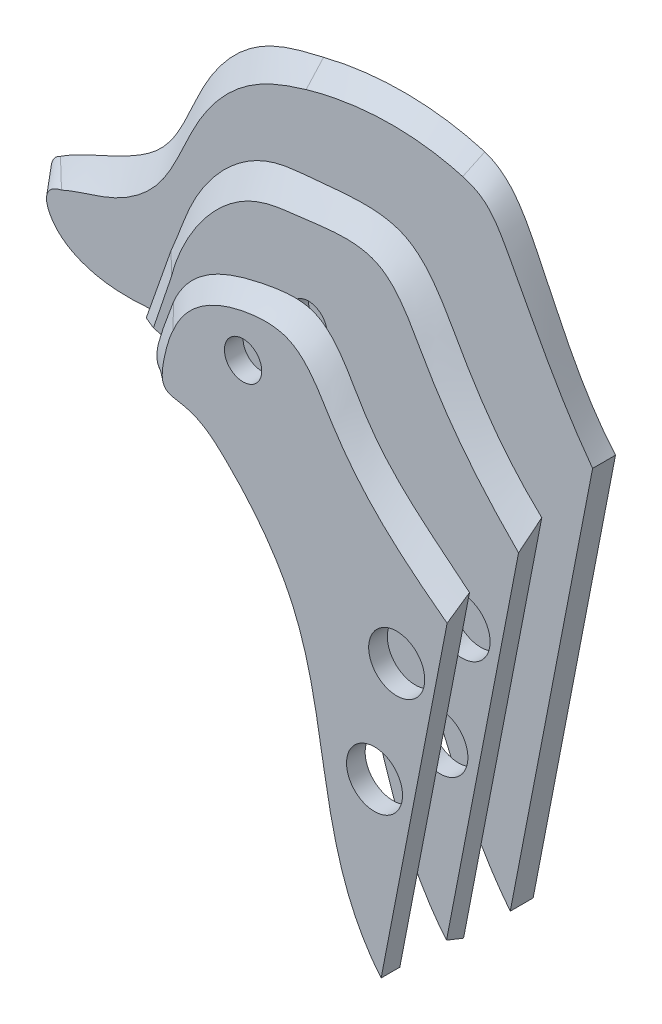
from build123d import *

# Parameters (mm, degrees)
SKETCH12_R         = 4
CUT_EXTRUDE1_DEPTH = 5
SKETCH10_R         = 4
CUT_EXTRUDE2_DEPTH = 5
CUT_EXTRUDE3_START = -18
SKETCH13_R         = 6
CUT_EXTRUDE3_DEPTH = 18
CUT_EXTRUDE4_START = -18
SKETCH14_R         = 6
CUT_EXTRUDE4_DEPTH = 18


with BuildPart() as part:
    # Loft4: read off the stored shape, not the designer's step
    # Loft4: loft between two sections, ruled curve by curve
    loft4_from = [
        Edge.make_bspline([(77.958571883, 18.995672942, 0), (69.81306901, 28.562918235, 0), (65.663673482, 39.687649157, 0), (58.332437588, 53.951272654, 0), (55.536112417, 58.481649378, 0), (51.421018516, 60.793800861, 0), (49.974275634, 61.268976489, 0)], [0, 0, 0, 0, 0.696575786, 0.725812228, 0.916565813, 1, 1, 1, 1], 3),
        Edge.make_bspline([(49.974275634, 61.268976489, 0), (49.505716798, 61.406841614, 0), (43.396175688, 63.117948118, 0), (31.692607742, 64.373316716, 0), (20.540624005, 62.818902632, 0), (15.436834961, 61.543674215, 0)], [0, 0, 0, 0, 0.041936811, 0.544812334, 1, 1, 1, 1], 3),
        Edge.make_bspline([(15.436834961, 61.543674215, 0), (15.229844727, 61.49722644, 0), (12.630046118, 60.909628297, 0), (8.852473068, 59.95517464, 0), (4.569159319, 58.262211831, 0), (2.290145257, 57.038982671, 0), (-0.755223748, 55.098290452, 0), (-5.087657656, 51.323943166, 0), (-8.529098205, 46.45825302, 0), (-10.270791417, 43.226753988, 0), (-11.925454756, 40.004551376, 0), (-13.772547956, 35.588722463, 0), (-16.615410908, 30.452471026, 0), (-18.758572682, 27.837546837, 0), (-19.892697716, 26.753522216, 0), (-22.268680775, 24.664616568, 0), (-25.527570244, 22.686326073, 0), (-30.393409006, 20.320590313, 0), (-35.158615589, 18.181790597, 0), (-38.845895672, 16.376295987, 0), (-40.910146468, 14.998995279, 0)], [0, 0, 0, 0, 0.008351016, 0.1049053, 0.153071192, 0.189385639, 0.206568258, 0.295206273, 0.414174613, 0.43957708, 0.43957708, 0.556768864, 0.627695873, 0.670087142, 0.689418603, 0.689418603, 0.794559115, 0.838688981, 0.902345365, 1, 1, 1, 1], 3),
        Edge.make_bspline([(-40.910146468, 14.998995279, 0), (-41.313718624, 14.828048382, 0), (-42.104713346, 14.297027207, 0), (-42.823987538, 12.995820262, 0), (-43.100731096, 10.874739053, 0), (-42.647398924, 9.090867466, 0), (-41.812446812, 7.502185164, 0), (-40.799579849, 6.038848574, 0), (-38.745656813, 4.170628409, 0), (-36.490997878, 2.800447275, 0), (-32.721357575, 0.934472543, 0), (-27.187395601, -0.751361165, 0), (-21.050868409, -1.183335038, 0), (-16.681022909, -1.174819004, 0), (-14.710339354, -1.134018104, 0), (-13.528988879, -1.088693105, 0), (-9.033717543, -0.8957394, 0), (-4.818646922, -0.756844424, 0), (1.897478031, -0.525083956, 0), (6.518900926, -0.327620546, 0), (11.135475759, -0.043294434, 0), (14.366054176, 0.188286269, 0), (16.103205928, 0.286260616, 0), (17.833902749, 0.197736688, 0), (19.708253567, -0.001939549, 0), (22.042342351, -0.610613913, 0), (24.756897545, -2.306849034, 0), (27.544732721, -4.919996212, 0), (30.666363777, -9.419394792, 0), (33.764700654, -16.327461193, 0), (35.669469236, -21.763825494, 0), (38.48766089, -29.778340729, 0), (41.341119491, -37.75819805, 0), (45.918265172, -48.893307205, 0), (51.231788136, -59.939494455, 0), (56.452163104, -67.78048221, 0), (60.323211324, -71.952286576, 0)], [0, 0, 0, 0, 0.00837307, 0.017762655, 0.027733621, 0.048779718, 0.05204074, 0.06201082, 0.082660237, 0.104704742, 0.112275845, 0.163078864, 0.214327654, 0.229400171, 0.246603709, 0.251993788, 0.251993788, 0.332593964, 0.332593964, 0.380426295, 0.420991626, 0.420991626, 0.442329007, 0.454134962, 0.454134962, 0.478345256, 0.499621291, 0.514833285, 0.551173963, 0.603629486, 0.659162578, 0.661233481, 0.765955244, 0.821108721, 0.891270538, 1, 1, 1, 1], 3),
        Edge.make_line((77.958571883, 18.995672942, 0), (60.323211324, -71.952286576, 0)),
    ]
    loft4_to = [
        Edge.make_bspline([(77.958571883, 18.995672942, 4.9), (70.675285123, 28.860678419, 4.9), (65.849031326, 38.760145453, 4.9), (58.400678834, 52.491068252, 4.9), (55.778104722, 57.167288543, 4.9), (51.491781801, 58.81911588, 4.9), (50.139948714, 59.21860019, 4.9)], [0, 0, 0, 0, 0.696575786, 0.725812228, 0.916565813, 1, 1, 1, 1], 3),
        Edge.make_bspline([(50.139948714, 59.21860019, 4.9), (49.677036293, 59.355396849, 4.9), (43.590822432, 60.975409128, 4.9), (32.309547383, 61.882945307, 4.9), (21.583293464, 60.023768009, 4.9), (16.609520864, 58.58584891, 4.9)], [0, 0, 0, 0, 0.041936811, 0.544812334, 1, 1, 1, 1], 3),
        Edge.make_bspline([(16.609520864, 58.58584891, 4.9), (16.416431661, 58.530026766, 4.9), (13.993166246, 57.818290236, 4.9), (10.501166746, 56.588137156, 4.9), (6.63124439, 54.646669896, 4.9), (4.574071078, 53.368454521, 4.9), (1.821241951, 51.395991788, 4.9), (-2.143696469, 47.723622385, 4.9), (-5.432090011, 43.076605166, 4.9), (-7.097627007, 39.999493185, 4.9), (-8.695049459, 36.936662836, 4.9), (-10.512640041, 32.752457976, 4.9), (-13.1096156, 27.93951048, 4.9), (-14.929448281, 25.403874873, 4.9), (-15.888560217, 24.302297962, 4.9), (-17.889502616, 22.132453113, 4.9), (-20.72457484, 19.867059753, 4.9), (-25.350118352, 17.475154803, 4.9), (-30.130276288, 15.798353409, 4.9), (-33.822410743, 14.672026557, 4.9), (-35.791116406, 13.75, 4.9)], [0, 0, 0, 0, 0.008351016, 0.1049053, 0.153071192, 0.189385639, 0.206568258, 0.295206273, 0.414174613, 0.43957708, 0.43957708, 0.556768864, 0.627695873, 0.670087142, 0.689418603, 0.689418603, 0.794559115, 0.838688981, 0.902345365, 1, 1, 1, 1], 3),
        Edge.make_bspline([(-35.791116406, 13.75, 4.9), (-36.468482867, 13.600033317, 4.9), (-37.638910897, 13.160589203, 4.9), (-38.700615101, 12.161648471, 4.9), (-39.24000611, 10.367918808, 4.9), (-38.629330815, 8.615115367, 4.9), (-37.679369076, 7.059468177, 4.9), (-36.59934843, 5.659407984, 4.9), (-34.490964387, 3.942949495, 4.9), (-32.12134693, 2.819795092, 4.9), (-28.187774047, 1.479861186, 4.9), (-22.677443886, 0.775369264, 4.9), (-16.670801527, 1.202620362, 4.9), (-12.405749376, 1.625965635, 4.9), (-10.491203974, 1.815280361, 4.9), (-9.348765228, 1.914923081, 4.9), (-5.005483296, 2.282083922, 4.9), (-1.001541337, 2.456989607, 4.9), (5.48641984, 2.653141126, 4.9), (9.996022261, 2.754429051, 4.9), (14.683270709, 2.87722852, 4.9), (17.786854709, 2.607843598, 4.9), (19.398195483, 2.363528433, 4.9), (20.877055705, 1.880390579, 4.9), (22.435534005, 1.26843352, 4.9), (24.27800178, 0.270403694, 4.9), (26.457340732, -1.552617288, 4.9), (28.833903759, -4.15075873, 4.9), (31.791100171, -8.600655202, 4.9), (35.10202664, -16.032322337, 4.9), (37.228190444, -22.181159642, 4.9), (40.330728791, -31.059627703, 4.9), (43.367787061, -39.563350008, 4.9), (47.924120058, -50.692640146, 4.9), (52.906874614, -61.175537076, 4.9), (57.307552014, -68.156327996, 4.9), (60.323211324, -71.952286576, 4.9)], [0, 0, 0, 0, 0.00837307, 0.017762655, 0.027733621, 0.048779718, 0.05204074, 0.06201082, 0.082660237, 0.104704742, 0.112275845, 0.163078864, 0.214327654, 0.229400171, 0.246603709, 0.251993788, 0.251993788, 0.332593964, 0.332593964, 0.380426295, 0.420991626, 0.420991626, 0.442329007, 0.454134962, 0.454134962, 0.478345256, 0.499621291, 0.514833285, 0.551173963, 0.603629486, 0.659162578, 0.661233481, 0.765955244, 0.821108721, 0.891270538, 1, 1, 1, 1], 3),
        Edge.make_line((77.958571883, 18.995672942, 4.9), (60.323211324, -71.952286576, 4.9)),
    ]
    loft4 = Solid(Shell([*[Face.make_surface_from_curves(loft4_from[k], loft4_to[k]) for k in range(5)], Face(Wire(loft4_from)), Face(Wire(loft4_to))]))
    add(loft4)


with BuildPart() as body_2:
    # Sketch5 → Loft5 section 0
    with BuildSketch(Plane.XY.offset(14.9)):
        with BuildLine():
            Line((-2.33970387, 24.231457774), (-7.638772242, 9.119299826))
            add(Edge.make_bspline(
                [(-7.638772242, 9.119299826), (-4.259737159, 8.836488543), (3.564253031, 8.997546536), (13.523482278, 6.127231205), (26.16330004, 2.319373894), (44.43095779, -25.390898016), (45.334066891, -53.607968411), (60.323211324, -71.952286576)],
                knots=[0, 0, 0, 0, 0.088461522, 0.200516231, 0.268799829, 0.424604481, 1, 1, 1, 1], degree=3))
            Line((60.323211324, -71.952286576), (77.071004751, 14.418368197))
            add(Edge.make_bspline(
                [(-2.33970387, 24.231457774), (-0.649462445, 28.043974331), (2.749318341, 39.4489624), (14.839002739, 51.983221928), (32.000008474, 52.956004986), (49.917527377, 55.590584627), (61.260685021, 33.127982199), (69.736181012, 21.279194864), (77.071004751, 14.418368197)],
                knots=[0.098402223, 0.098402223, 0.098402223, 0.098402223, 0.201232002, 0.385973715, 0.462712781, 0.619617817, 0.766138376, 1, 1, 1, 1], degree=3))
        make_face()
    # Sketch6 → Loft5 section 1
    with BuildSketch(Plane.XY.offset(18.9)):
        with BuildLine():
            Line((1.805661875, 23.611468216), (-2.106052036, 12.026777016))
            add(Edge.make_bspline(
                [(-2.106052036, 12.026777016), (-0.176816244, 11.460107512), (5.723325627, 10.288611472), (14.529854717, 9.181118287), (26.887283715, 3.894835269), (45.87957013, -22.763566155), (45.99023137, -52.362533526), (60.669117652, -70.168400468)],
                knots=[0, 0, 0, 0, 0.05418243, 0.162213331, 0.238719582, 0.409718142, 1, 1, 1, 1], degree=3))
            Line((60.669117652, -70.168400468), (76.099905897, 9.410278968))
            add(Edge.make_bspline(
                [(1.805661875, 23.611468216), (4.11120708, 32.881209243), (13.470463933, 46.796093686), (31.965092626, 48.488438301), (47.627870259, 51.15797756), (58.535684353, 28.947486353), (67.966130648, 17.559576155), (76.099905897, 9.410278968)],
                knots=[0, 0, 0, 0, 0.29272325, 0.378195244, 0.535380098, 0.684633531, 1, 1, 1, 1], degree=3))
        make_face()
    loft()

    # Sketch10 → Cut-Extrude2 (cut)
    with BuildSketch(Plane.XY.offset(18.9)):
        with Locations((31.099905897, 29.611468216)):
            Circle(SKETCH10_R)
    extrude(amount=-CUT_EXTRUDE2_DEPTH, mode=Mode.SUBTRACT)


with BuildPart() as body_3:
    # Sketch7 → Loft6 section 0
    with BuildSketch(Plane.XY.offset(28.9)):
        with BuildLine():
            Line((75.591011754, 6.78584247), (60.669117652, -70.168400468))
            add(Edge.make_bspline(
                [(12.177797159, 28.978383554), (11.714671799, 27.682861592), (9.545521698, 22.265916858), (7.332285498, 13.577254844), (18.755760071, 12.591081512), (29.878800117, 5.022551236), (49.07933072, -22.632601206), (46.43319288, -52.833378836), (60.669117652, -70.168400468)],
                knots=[0, 0, 0, 0, 0.063473984, 0.118425302, 0.193565341, 0.283413177, 0.473561281, 1, 1, 1, 1], degree=3))
            add(Edge.make_bspline(
                [(12.177797159, 28.978383554), (15.860066232, 37.551496463), (26.66302196, 41.722007027), (45.558539362, 43.963440527), (54.813924214, 22.449728962), (66.995121102, 13.975144142), (75.591011754, 6.78584247)],
                knots=[0, 0, 0, 0, 0.297065367, 0.416843154, 0.620426244, 1, 1, 1, 1], degree=3))
        make_face()
    # Sketch8 → Loft6 section 1
    with BuildSketch(Plane.XY.offset(32.9)):
        with BuildLine():
            Line((74.799694302, 2.704910449), (60.669117652, -70.168400468))
            add(Edge.make_bspline(
                [(16.110149857, 27.596072915), (15.613295846, 26.95874249), (13.889109908, 21.589390116), (13.424136685, 15.335541349), (21.146144328, 14.927144958), (30.801201788, 6.582722179), (51.660624498, -19.832531712), (46.391604142, -53.00114424), (60.669117652, -70.168400468)],
                knots=[0, 0, 0, 0, 0.061869174, 0.104877434, 0.140990087, 0.232652655, 0.442154724, 1, 1, 1, 1], degree=3))
            add(Edge.make_bspline(
                [(16.110149857, 27.596072915), (18.813902895, 34.397349762), (27.779975561, 39.277046129), (43.52382802, 39.509986545), (53.472220526, 19.735534848), (64.887353701, 10.109533323), (74.799694302, 2.704910449)],
                knots=[0, 0, 0, 0, 0.260298727, 0.368155133, 0.556330145, 1, 1, 1, 1], degree=3))
        make_face()
    loft()

    # Sketch12 → Cut-Extrude1 (cut)
    with BuildSketch(Plane(origin=(0, 0, 28.9), x_dir=(-1, 0, 0), z_dir=(0, 0, -1))):
        with Locations((-31.099905897, 29.611468216)):
            Circle(SKETCH12_R)
    extrude(amount=-CUT_EXTRUDE1_DEPTH, mode=Mode.SUBTRACT)


with BuildPart() as cut_extrude3_tool:
    # Sketch13 → Cut-Extrude3 (new body)
    with BuildSketch(Plane.XY.offset(32.9).offset(CUT_EXTRUDE3_START)):
        with Locations((64, -10.168400468)):
            Circle(SKETCH13_R)
    extrude(amount=CUT_EXTRUDE3_DEPTH)


with BuildPart() as body_2_1:
    add(body_2.part)

    # Cut-Extrude3: cut by cut_extrude3_tool
    add(cut_extrude3_tool.part, mode=Mode.SUBTRACT)


with BuildPart() as body_3_1:
    add(body_3.part)

    # Cut-Extrude3: cut by cut_extrude3_tool
    add(cut_extrude3_tool.part, mode=Mode.SUBTRACT)


with BuildPart() as cut_extrude4_tool:
    # Sketch14 → Cut-Extrude4 (new body)
    with BuildSketch(Plane.XY.offset(32.9).offset(CUT_EXTRUDE4_START)):
        with Locations((59.25, -34)):
            Circle(SKETCH14_R)
    extrude(amount=CUT_EXTRUDE4_DEPTH)


with BuildPart() as body_2_2:
    add(body_2_1.part)

    # Cut-Extrude4: cut by cut_extrude4_tool
    add(cut_extrude4_tool.part, mode=Mode.SUBTRACT)


with BuildPart() as body_3_2:
    add(body_3_1.part)

    # Cut-Extrude4: cut by cut_extrude4_tool
    add(cut_extrude4_tool.part, mode=Mode.SUBTRACT)


solid = Compound([part.part, body_2_2.part, body_3_2.part])
